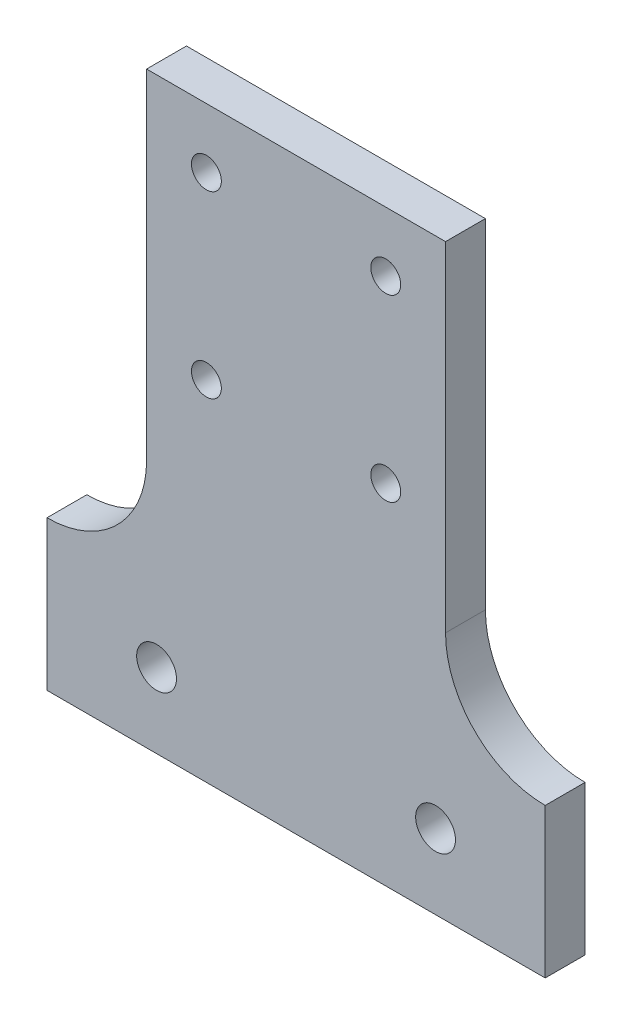
from build123d import *

# Parameters (mm, degrees)
EXTRUDE_1_DEPTH     = 4
SKETCH_2_R          = 1.5
CUT_EXTRUDE_1_DEPTH = 65.202803677
SKETCH_3_R          = 2
CUT_EXTRUDE_2_DEPTH = 65.202803677
FILLET_1_R          = 10


with BuildPart() as part:
    # 草图1 → 凸台-拉伸1 (new body)
    with BuildSketch(Plane.XY):
        Polygon((25, 0), (-25, 0), (-25, 15), (-15, 15), (-15, 59), (15, 59), (15, 15), (25, 15), align=None)
    extrude(amount=EXTRUDE_1_DEPTH)

    # 草图2 → 切除-拉伸1 (cut, through all)
    with BuildSketch(Plane.XY.offset(4)):
        with Locations((-9, 53)):
            Circle(SKETCH_2_R)
        with Locations((-9, 35)):
            Circle(SKETCH_2_R)
        with Locations((9, 35)):
            Circle(SKETCH_2_R)
        with Locations((9, 53)):
            Circle(SKETCH_2_R)
    extrude(amount=-CUT_EXTRUDE_1_DEPTH, mode=Mode.SUBTRACT)

    # 草图3 → 切除-拉伸2 (cut, through all)
    with BuildSketch(Plane.XY.offset(4)):
        with Locations((-14, 7.5)):
            Circle(SKETCH_3_R)
        with Locations(Location((14, 7.5, 0), (0, 0, 180))):
            Circle(SKETCH_3_R)
    extrude(amount=-CUT_EXTRUDE_2_DEPTH, mode=Mode.SUBTRACT)

    # 圆角1
    fillet_1_edges = [part.edges().sort_by_distance(p)[0] for p in [
        (-15, 15, 2),
        (15, 15, 2),
    ]]
    fillet(fillet_1_edges, radius=FILLET_1_R - 0.0001)  # a hair under: the kernel refuses the full size


solid = part.part
